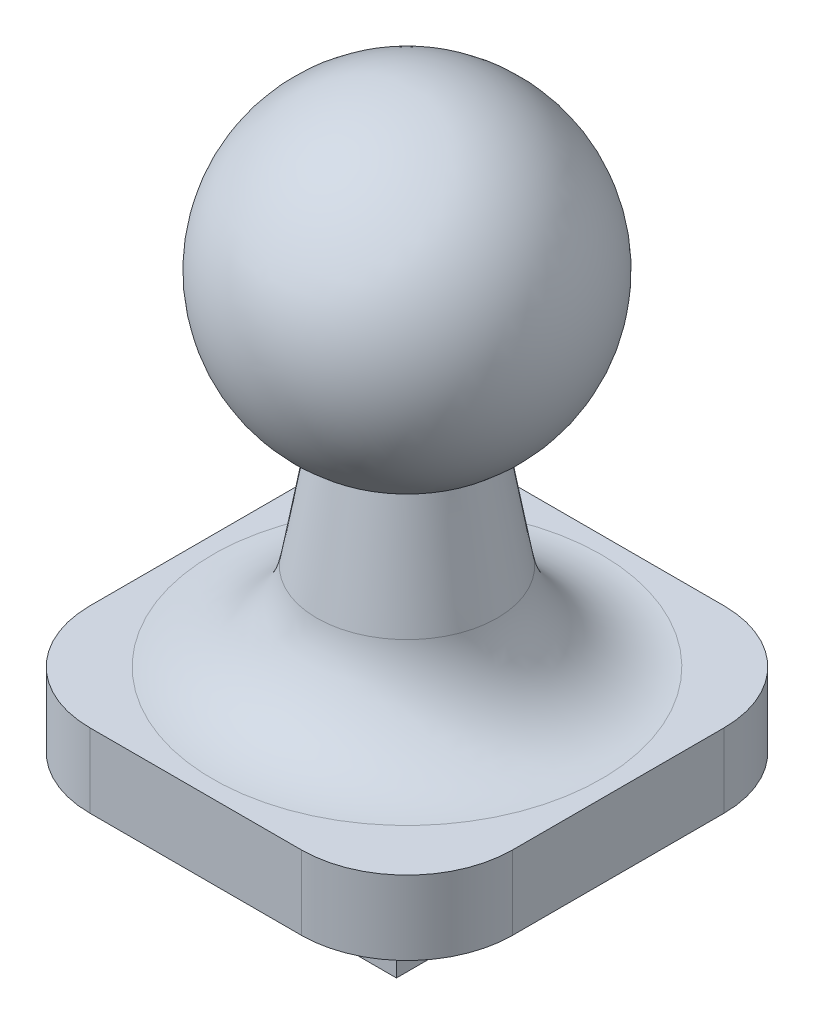
from build123d import *

# Parameters (mm, degrees)
SKETCH1_W           = 20
SKETCH1_H           = 20
BOSS_EXTRUDE1_DEPTH = 3.5
SKETCH2_R           = 5
BOSS_EXTRUDE2_DEPTH = 10
CHAMFER1_SIZE       = 10
CHAMFER1_SIZE_2     = 1.763269807
FILLET1_R           = 5
FILLET2_R           = 5
SKETCH9_W           = 2
SKETCH9_H           = 8
BOSS_EXTRUDE4_DEPTH = 4
SKETCH10_W          = 7
SKETCH10_H          = 8
BOSS_EXTRUDE5_DEPTH = 1.5
FILLET3_SIZE        = 0.5
FILLET3_SIZE_2      = 1


# Read off the part's stored shape, not the designer's step: Revolve5
with BuildPart() as part:
    # Sketch1 → Boss-Extrude1 (new body)
    with BuildSketch(Plane(origin=(0, 0, 0), x_dir=(1, 0, 0), z_dir=(0, 1, 0))):
        Rectangle(SKETCH1_W, SKETCH1_H)
    extrude(amount=BOSS_EXTRUDE1_DEPTH)

    # Sketch2 → Boss-Extrude2 (add)
    with BuildSketch(Plane(origin=(0, 3.5, 0), x_dir=(1, 0, 0), z_dir=(0, 1, 0))):
        with Locations(Location((0, 0, 0), (0, 0, 270))):
            Circle(SKETCH2_R)
    extrude(amount=BOSS_EXTRUDE2_DEPTH)

    # Chamfer1
    # the kernel refuses this chamfer: 10, 1.763269807 mm, written as the material it takes off along each edge
    with BuildSketch(Plane(origin=(0, 13.5, 0), x_dir=(0, 0, 1), z_dir=(-1, 0, 0))) as chamfer1_piece_1_section:
        Polygon((5, -CHAMFER1_SIZE), (5 - CHAMFER1_SIZE_2, 0), (5, 0), align=None)
    chamfer1_piece_1 = revolve(axis=Axis((0, 13.5, 0), (0, 1, 0)), mode=Mode.PRIVATE)
    chamfer1_piece_1 = split(chamfer1_piece_1, bisect_by=Plane(origin=(0, 3.5, -4.151256053), z_dir=(0, 1, 0)), keep=Keep.TOP, mode=Mode.PRIVATE)
    add(chamfer1_piece_1, mode=Mode.SUBTRACT)

    # Fillet1
    fillet1_edges = [part.edges().sort_by_distance(p)[0] for p in [
        (10, 1.75, 10),
        (-10, 1.75, 10),
        (-10, 1.75, -10),
        (10, 1.75, -10),
    ]]
    fillet(fillet1_edges, radius=FILLET1_R)

    # Revolve5 outline → Revolve5 (revolve)
    with BuildSketch(Plane.XY):
        with BuildLine():
            ThreePointArc((3.320470439, 13.025085423), (7.303658649, 21.454866662), (0, 27.25))
            Line((0, 27.25), (0, 13.5))
            Line((0, 13.5), (3.236730193, 13.5))
            Line((3.236730193, 13.5), (3.236730193, 13.025085423))
            Line((3.236730193, 13.025085423), (3.320470439, 13.025085423))
        make_face()
    revolve(axis=Axis((0, 0, 0), (0, 1, 0)))

    # Fillet2
    fillet2_edges = [part.edges().sort_by_distance(p)[0] for p in [
        (0, 3.5, -5),
    ]]
    fillet(fillet2_edges, radius=FILLET2_R)

    # Sketch9 → Boss-Extrude4 (add)
    with BuildSketch(Plane.XZ):
        Rectangle(SKETCH9_W, SKETCH9_H)
    extrude(amount=BOSS_EXTRUDE4_DEPTH)

    # Sketch10 → Boss-Extrude5 (add)
    with BuildSketch(Plane(origin=(0, -4, 0), x_dir=(-1, 0, 0), z_dir=(0, -1, 0))):
        Rectangle(SKETCH10_W, SKETCH10_H)
    extrude(amount=BOSS_EXTRUDE5_DEPTH)

    # Fillet3
    # an asymmetric fillet: 1, 0.5 mm, written as the material it adds along each edge
    with BuildSketch(Plane(origin=(1, 0, -4), x_dir=(0, -1, 0), z_dir=(0, 0, 1)), Plane(origin=(-1, 0, 4), x_dir=(0, -1, 0), z_dir=(0, 0, -1))) as fillet3_piece_1:
        with BuildLine():
            Bezier((FILLET3_SIZE, 0), (0, 0), (0, FILLET3_SIZE_2), weights=[1, 0.707106781, 1])
            Line((0, FILLET3_SIZE_2), (0, 0))
            Line((0, 0), (FILLET3_SIZE, 0))
        make_face()
    extrude(amount=8)
    with BuildSketch(Plane(origin=(1, 0, 4), x_dir=(0, -1, 0), z_dir=(-1, 0, 0)), Plane(origin=(-1, 0, -4), x_dir=(0, -1, 0), z_dir=(1, 0, 0))) as fillet3_piece_2:
        with BuildLine():
            Bezier((FILLET3_SIZE, 0), (0, 0), (0, FILLET3_SIZE_2), weights=[1, 0.707106781, 1])
            Line((0, FILLET3_SIZE_2), (0, 0))
            Line((0, 0), (FILLET3_SIZE, 0))
        make_face()
    extrude(amount=2)
    with BuildSketch(Plane(origin=(-1, 0, -4), x_dir=(0, -1, 0), z_dir=(1, 0, 0))) as fillet3_piece_3a_section:
        with BuildLine():
            Bezier((FILLET3_SIZE, 0), (0, 0), (0, FILLET3_SIZE_2), weights=[1, 0.707106781, 1])
            Line((0, FILLET3_SIZE_2), (0, 0))
            Line((0, 0), (FILLET3_SIZE, 0))
        make_face()
    fillet3_piece_3a = extrude(amount=4.5, mode=Mode.PRIVATE)
    fillet3_piece_3a = split(fillet3_piece_3a, bisect_by=Plane(origin=(1, -0.103701438, -4.24592111), z_dir=(1, 0, 0)), keep=Keep.TOP, mode=Mode.PRIVATE)
    with BuildSketch(Plane(origin=(1, 0, -6.5), x_dir=(0, -1, 0), z_dir=(0, 0, 1))) as fillet3_piece_3b_section:
        with BuildLine():
            Bezier((FILLET3_SIZE, 0), (0, 0), (0, FILLET3_SIZE_2), weights=[1, 0.707106781, 1])
            Line((0, FILLET3_SIZE_2), (0, 0))
            Line((0, 0), (FILLET3_SIZE, 0))
        make_face()
    fillet3_piece_3b = extrude(amount=10.5, mode=Mode.PRIVATE)
    fillet3_piece_3b = split(fillet3_piece_3b, bisect_by=Plane(origin=(1.245921261, -0.103701518, -4), z_dir=(0, 0, -1)), keep=Keep.TOP, mode=Mode.PRIVATE)
    fillet3_piece_3 = fillet3_piece_3a & fillet3_piece_3b
    add(fillet3_piece_3)
    with BuildSketch(Plane(origin=(3.5, 0, 4), x_dir=(0, -1, 0), z_dir=(-1, 0, 0))) as fillet3_piece_4a_section:
        with BuildLine():
            Bezier((FILLET3_SIZE, 0), (0, 0), (0, FILLET3_SIZE_2), weights=[1, 0.707106781, 1])
            Line((0, FILLET3_SIZE_2), (0, 0))
            Line((0, 0), (FILLET3_SIZE, 0))
        make_face()
    fillet3_piece_4a = extrude(amount=4.5, mode=Mode.PRIVATE)
    fillet3_piece_4a = split(fillet3_piece_4a, bisect_by=Plane(origin=(1, -0.103701518, 4.245921261), z_dir=(1, 0, 0)), keep=Keep.TOP, mode=Mode.PRIVATE)
    with BuildSketch(Plane(origin=(1, 0, -4), x_dir=(0, -1, 0), z_dir=(0, 0, 1))) as fillet3_piece_4b_section:
        with BuildLine():
            Bezier((FILLET3_SIZE, 0), (0, 0), (0, FILLET3_SIZE_2), weights=[1, 0.707106781, 1])
            Line((0, FILLET3_SIZE_2), (0, 0))
            Line((0, 0), (FILLET3_SIZE, 0))
        make_face()
    fillet3_piece_4b = extrude(amount=10.5, mode=Mode.PRIVATE)
    fillet3_piece_4b = split(fillet3_piece_4b, bisect_by=Plane(origin=(1.24592111, -0.103701438, 4), z_dir=(0, 0, 1)), keep=Keep.TOP, mode=Mode.PRIVATE)
    fillet3_piece_4 = fillet3_piece_4a & fillet3_piece_4b
    add(fillet3_piece_4)
    with BuildSketch(Plane(origin=(1, 0, 4), x_dir=(0, -1, 0), z_dir=(-1, 0, 0))) as fillet3_piece_5a_section:
        with BuildLine():
            Bezier((FILLET3_SIZE, 0), (0, 0), (0, FILLET3_SIZE_2), weights=[1, 0.707106781, 1])
            Line((0, FILLET3_SIZE_2), (0, 0))
            Line((0, 0), (FILLET3_SIZE, 0))
        make_face()
    fillet3_piece_5a = extrude(amount=4.5, mode=Mode.PRIVATE)
    fillet3_piece_5a = split(fillet3_piece_5a, bisect_by=Plane(origin=(-1, -0.103701438, 4.24592111), z_dir=(-1, 0, 0)), keep=Keep.TOP, mode=Mode.PRIVATE)
    with BuildSketch(Plane(origin=(-1, 0, 6.5), x_dir=(0, -1, 0), z_dir=(0, 0, -1))) as fillet3_piece_5b_section:
        with BuildLine():
            Bezier((FILLET3_SIZE, 0), (0, 0), (0, FILLET3_SIZE_2), weights=[1, 0.707106781, 1])
            Line((0, FILLET3_SIZE_2), (0, 0))
            Line((0, 0), (FILLET3_SIZE, 0))
        make_face()
    fillet3_piece_5b = extrude(amount=10.5, mode=Mode.PRIVATE)
    fillet3_piece_5b = split(fillet3_piece_5b, bisect_by=Plane(origin=(-1.245921261, -0.103701518, 4), z_dir=(0, 0, 1)), keep=Keep.TOP, mode=Mode.PRIVATE)
    fillet3_piece_5 = fillet3_piece_5a & fillet3_piece_5b
    add(fillet3_piece_5)
    with BuildSketch(Plane(origin=(-3.5, 0, -4), x_dir=(0, -1, 0), z_dir=(1, 0, 0))) as fillet3_piece_6a_section:
        with BuildLine():
            Bezier((FILLET3_SIZE, 0), (0, 0), (0, FILLET3_SIZE_2), weights=[1, 0.707106781, 1])
            Line((0, FILLET3_SIZE_2), (0, 0))
            Line((0, 0), (FILLET3_SIZE, 0))
        make_face()
    fillet3_piece_6a = extrude(amount=4.5, mode=Mode.PRIVATE)
    fillet3_piece_6a = split(fillet3_piece_6a, bisect_by=Plane(origin=(-1, -0.103701518, -4.245921261), z_dir=(-1, 0, 0)), keep=Keep.TOP, mode=Mode.PRIVATE)
    with BuildSketch(Plane(origin=(-1, 0, 4), x_dir=(0, -1, 0), z_dir=(0, 0, -1))) as fillet3_piece_6b_section:
        with BuildLine():
            Bezier((FILLET3_SIZE, 0), (0, 0), (0, FILLET3_SIZE_2), weights=[1, 0.707106781, 1])
            Line((0, FILLET3_SIZE_2), (0, 0))
            Line((0, 0), (FILLET3_SIZE, 0))
        make_face()
    fillet3_piece_6b = extrude(amount=10.5, mode=Mode.PRIVATE)
    fillet3_piece_6b = split(fillet3_piece_6b, bisect_by=Plane(origin=(-1.24592111, -0.103701438, -4), z_dir=(0, 0, -1)), keep=Keep.TOP, mode=Mode.PRIVATE)
    fillet3_piece_6 = fillet3_piece_6a & fillet3_piece_6b
    add(fillet3_piece_6)


solid = part.part
